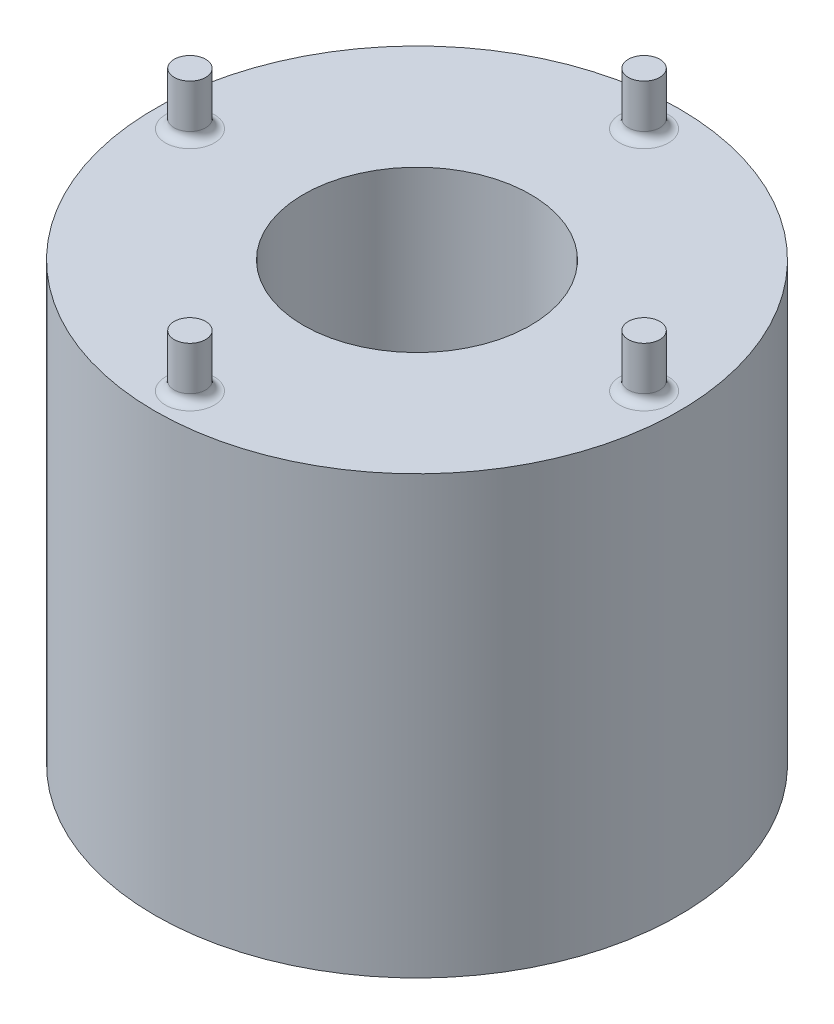
from build123d import *

# Parameters (mm, degrees)
SKETCH1_R                = 15
BOSS_EXTRUDE1_DEPTH      = 10
SKETCH2_R                = 15
BOSS_EXTRUDE2_DEPTH      = 15
SKETCH3_R                = 0.9
BOSS_EXTRUDE3_DEPTH      = 3
FILLET1_R                = 0.5
CIRPATTERN1_COUNT        = 4
FILLET1_OF_CIRPATTERN1_R = 0.5
SKETCH5_R                = 6.5
CUT_EXTRUDE1_DEPTH       = 10
SKETCH6_R                = 1.75
CUT_EXTRUDE2_DEPTH       = 10


with BuildPart() as part:
    # Sketch1 → Boss-Extrude1 (new body)
    with BuildSketch(Plane(origin=(0, 0, 0), x_dir=(1, 0, 0), z_dir=(0, 1, 0))):
        Circle(SKETCH1_R)
    extrude(amount=BOSS_EXTRUDE1_DEPTH)

    # Sketch2 → Boss-Extrude2 (add)
    with BuildSketch(Plane(origin=(0, 10, 0), x_dir=(1, 0, 0), z_dir=(0, 1, 0))):
        Circle(SKETCH2_R)
    extrude(amount=BOSS_EXTRUDE2_DEPTH)

    # Sketch3 → Boss-Extrude3 (add)
    with BuildSketch(Plane(origin=(0, 25, 0), x_dir=(1, 0, 0), z_dir=(0, 1, 0))):
        with Locations((0, -13)):
            Circle(SKETCH3_R)
    boss_extrude3 = extrude(amount=BOSS_EXTRUDE3_DEPTH)

    # Fillet1
    fillet1_edges = [part.edges().sort_by_distance(p)[0] for p in [
        (-0.9, 25, 13),
    ]]
    fillet(fillet1_edges, radius=FILLET1_R)

    # CirPattern1: Boss-Extrude3 ×4 about axis
    cirpattern1_axis = Axis((0, 25, 0), (0, 1, 0))
    for i in range(1, CIRPATTERN1_COUNT):
        add(boss_extrude3.rotate(cirpattern1_axis, i * 360 / CIRPATTERN1_COUNT))

    # Fillet1 of CirPattern1
    fillet1_of_cirpattern1_edges = [part.edges().sort_by_distance(p)[0] for p in [
        (13, 25, 0.9),
        (0.9, 25, -13),
        (-13, 25, -0.9),
    ]]
    fillet(fillet1_of_cirpattern1_edges, radius=FILLET1_OF_CIRPATTERN1_R)

    # Sketch5 → Cut-Extrude1 (cut)
    with BuildSketch(Plane(origin=(0, 25, 0), x_dir=(1, 0, 0), z_dir=(0, 1, 0))):
        Circle(SKETCH5_R)
    extrude(amount=-CUT_EXTRUDE1_DEPTH, mode=Mode.SUBTRACT)

    # Sketch6 → Cut-Extrude2 (cut)
    with BuildSketch(Plane(origin=(0, 15, 0), x_dir=(1, 0, 0), z_dir=(0, 1, 0))):
        Circle(SKETCH6_R)
    extrude(amount=-CUT_EXTRUDE2_DEPTH, mode=Mode.SUBTRACT)


solid = part.part
